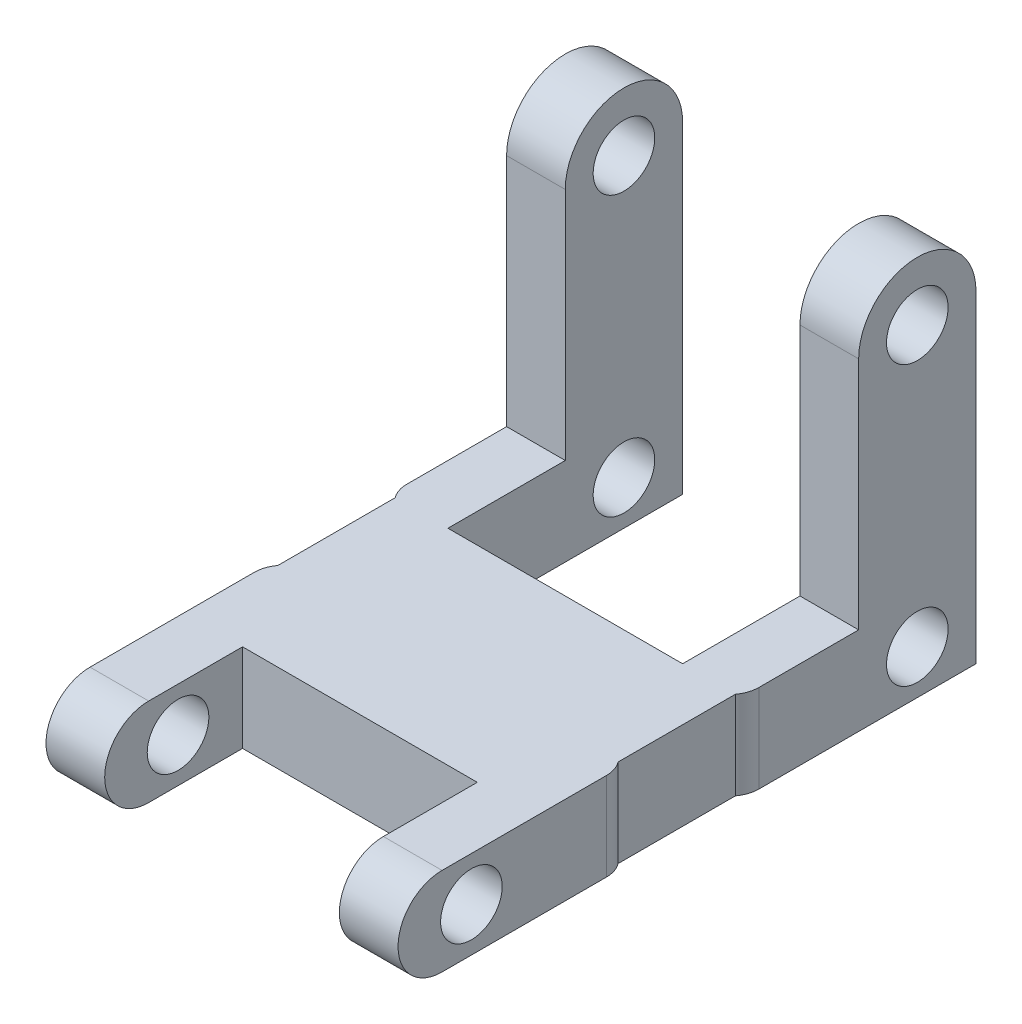
from build123d import *

# Parameters (mm, degrees)
EXTRUDE_1_DEPTH          = 3
SKETCH_2_OUTSIDE_W       = 13.724
SKETCH_2_OUTSIDE_H       = 8.024
CUT_EXTRUDE_1_DEPTH      = 12
SKETCH_3_R               = 1.05
CUT_EXTRUDE_2_DEPTH      = 12
SKETCH_4_R               = 0.95
EXTRUDE_2_DEPTH          = 4
SKETCH_5_W               = 12
SKETCH_5_H               = 3
EXTRUDE_3_DEPTH          = 8
SKETCH_6_R               = 1.05
CUT_EXTRUDE_3_DEPTH      = 12
SKETCH_8_W               = 8
SKETCH_8_H               = 4
CUT_EXTRUDE_4_DEPTH      = 8
EXTRUDE_5_DEPTH          = 2
SKETCH_12_W              = 11.6
SKETCH_12_H              = 3
EXTRUDE_8_DEPTH          = 4
FILLET_1_R               = 1
SKETCH_13_W              = 8
SKETCH_13_H              = 4
CUT_EXTRUDE_5_DEPTH      = 10
FILLET_2_R               = 1
CUT_EXTRUDE_6_DEPTH      = 21.322401433
CUT_EXTRUDE_6_DEPTH_BACK = 21.322401433
SKETCH_11_R              = 1.05


with BuildPart() as part:
    # 草图1 → 凸台-拉伸1 (new body)
    with BuildSketch(Plane(origin=(0, 0, 0), x_dir=(1, 0, 0), z_dir=(0, 1, 0))):
        Polygon((-6, 0), (6, 0), (6, -8.7), (4, -8.7), (4, -3), (-4, -3), (-4, -8.7), (-6, -8.7), align=None)
    extrude(amount=EXTRUDE_1_DEPTH)

    # 草图2 outside → 切除-拉伸1 (cut)
    with BuildSketch(Plane.ZY.offset(6)):
        with Locations((4.35, 1.5)):
            Rectangle(SKETCH_2_OUTSIDE_W, SKETCH_2_OUTSIDE_H)
        with BuildLine():
            Line((6.2, 3), (0, 3))
            Line((0, 3), (0, 0))
            Line((0, 0), (6.2, 0))
            ThreePointArc((6.2, 0), (7.7, 1.5), (6.2, 3))
        make_face(mode=Mode.SUBTRACT)
    extrude(amount=-CUT_EXTRUDE_1_DEPTH, mode=Mode.SUBTRACT)

    # 草图3 → 切除-拉伸2 (cut)
    with BuildSketch(Plane.ZY.offset(6)):
        with Locations((5.2, 1.5)):
            Circle(SKETCH_3_R)
    extrude(amount=-CUT_EXTRUDE_2_DEPTH, mode=Mode.SUBTRACT)

    # 草图4 → 凸台-拉伸2 (add)
    with BuildSketch(Plane(origin=(0, 0, 0), x_dir=(-1, 0, 0), z_dir=(0, 0, -1))):
        with Locations((0, 1.5)):
            Circle(SKETCH_4_R)
    extrude(amount=EXTRUDE_2_DEPTH)

    # 草图5 → 凸台-拉伸3 (add)
    with BuildSketch(Plane(origin=(0, 0, -4), x_dir=(-1, 0, 0), z_dir=(0, 0, -1))):
        with Locations((0, 1.5)):
            Rectangle(SKETCH_5_W, SKETCH_5_H)
    extrude(amount=EXTRUDE_3_DEPTH)

    # 草图6 → 切除-拉伸3 (cut)
    with BuildSketch(Plane(origin=(6, 0, 0), x_dir=(0, 0, -1), z_dir=(1, 0, 0))):
        with Locations(Location((10, 1.5, 0), (0, 0, 90))):
            Circle(SKETCH_6_R)
    extrude(amount=-CUT_EXTRUDE_3_DEPTH, mode=Mode.SUBTRACT)

    # 草图8 → 切除-拉伸4 (cut)
    with BuildSketch(Plane(origin=(0, 3, 0), x_dir=(1, 0, 0), z_dir=(0, 1, 0))):
        with Locations((0, 10)):
            Rectangle(SKETCH_8_W, SKETCH_8_H)
    extrude(amount=-CUT_EXTRUDE_4_DEPTH, mode=Mode.SUBTRACT)

    # 草图10 → 凸台-拉伸5 (add)
    with BuildSketch(Plane.ZY.offset(6)):
        with BuildLine():
            Line((-12, 3), (-8, 3))
            Line((-8, 3), (-8, 11))
            ThreePointArc((-8, 11), (-10, 13), (-12, 11))
            Line((-12, 11), (-12, 3))
        make_face()
    extrude_5 = extrude(amount=-EXTRUDE_5_DEPTH)

    # 镜向1: 凸台-拉伸5 across plane
    add(extrude_5.mirror(Plane(origin=(0, 0, 0), x_dir=(0, 0, 1), z_dir=(1, 0, 0))))

    # 草图12 → 凸台-拉伸8 (add)
    with BuildSketch(Plane.XY.offset(-4)):
        with Locations((0, 1.5)):
            Rectangle(SKETCH_12_W, SKETCH_12_H)
    extrude(amount=EXTRUDE_8_DEPTH)

    # 圆角1
    # the kernel refuses this fillet: 1 mm, written as the material it takes off along each edge
    with BuildSketch(Plane(origin=(6, -1.5, 0), x_dir=(-1, 0, 0), z_dir=(0, 1, 0))) as fillet_1_piece_1:
        with BuildLine():
            CenterArc((1, 0.6), FILLET_1_R, 180, 36.869897646)
            Line((0, 0.6), (-0.02, 0.6))
            Line((-0.02, 0.6), (-0.02, 0))
            Line((-0.02, 0), (0, -0.02))
            ThreePointArc((0, -0.02), (0.1, -0.02), (0.184, -0.012))
            Line((0.184, -0.012), (0.2, 0))
        make_face()
    extrude(amount=6, mode=Mode.SUBTRACT)
    with BuildSketch(Plane(origin=(-6, -1.5, 0), x_dir=(1, 0, 0), z_dir=(0, 1, 0))) as fillet_1_piece_2:
        with BuildLine():
            CenterArc((1, -0.6), FILLET_1_R, 143.130102354, 36.869897646)
            Line((0, -0.6), (-0.02, -0.6))
            Line((-0.02, -0.6), (-0.02, 0))
            Line((-0.02, 0), (0, 0.02))
            ThreePointArc((0, 0.02), (0.1, 0.02), (0.184, 0.012))
            Line((0.184, 0.012), (0.2, 0))
        make_face()
    extrude(amount=6, mode=Mode.SUBTRACT)

    # 草图13 → 切除-拉伸5 (cut)
    with BuildSketch(Plane(origin=(0, 3, 0), x_dir=(1, 0, 0), z_dir=(0, 1, 0))):
        with Locations((0, 6)):
            Rectangle(SKETCH_13_W, SKETCH_13_H)
    extrude(amount=-CUT_EXTRUDE_5_DEPTH, mode=Mode.SUBTRACT)

    # 圆角2
    # the kernel refuses this fillet: 1 mm, written as the material it takes off along each edge
    with BuildSketch(Plane(origin=(-6, 4.5, -4), x_dir=(0, 0, -1), z_dir=(0, -1, 0)), Plane(origin=(6, -1.5, -4), x_dir=(0, 0, -1), z_dir=(0, 1, 0))) as fillet_2_piece_1:
        with BuildLine():
            CenterArc((0.6, 1), FILLET_2_R, 233.130102354, 36.869897646)
            Line((0, 0.2), (-0.012, 0.184))
            ThreePointArc((-0.012, 0.184), (-0.02, 0.1), (-0.02, 0))
            Line((-0.02, 0), (0, -0.02))
            Line((0, -0.02), (0.6, -0.02))
            Line((0.6, -0.02), (0.6, 0))
        make_face()
    extrude(amount=6, mode=Mode.SUBTRACT)

    # 草图11 → 切除-拉伸6 (cut, two sides: drawn at the far end of the back side and taken through both)
    with BuildSketch(Plane.ZY.offset(4).offset(-CUT_EXTRUDE_6_DEPTH_BACK)):
        with Locations((-10, 11)):
            Circle(SKETCH_11_R)
    extrude(amount=CUT_EXTRUDE_6_DEPTH + CUT_EXTRUDE_6_DEPTH_BACK, mode=Mode.SUBTRACT)


solid = part.part
